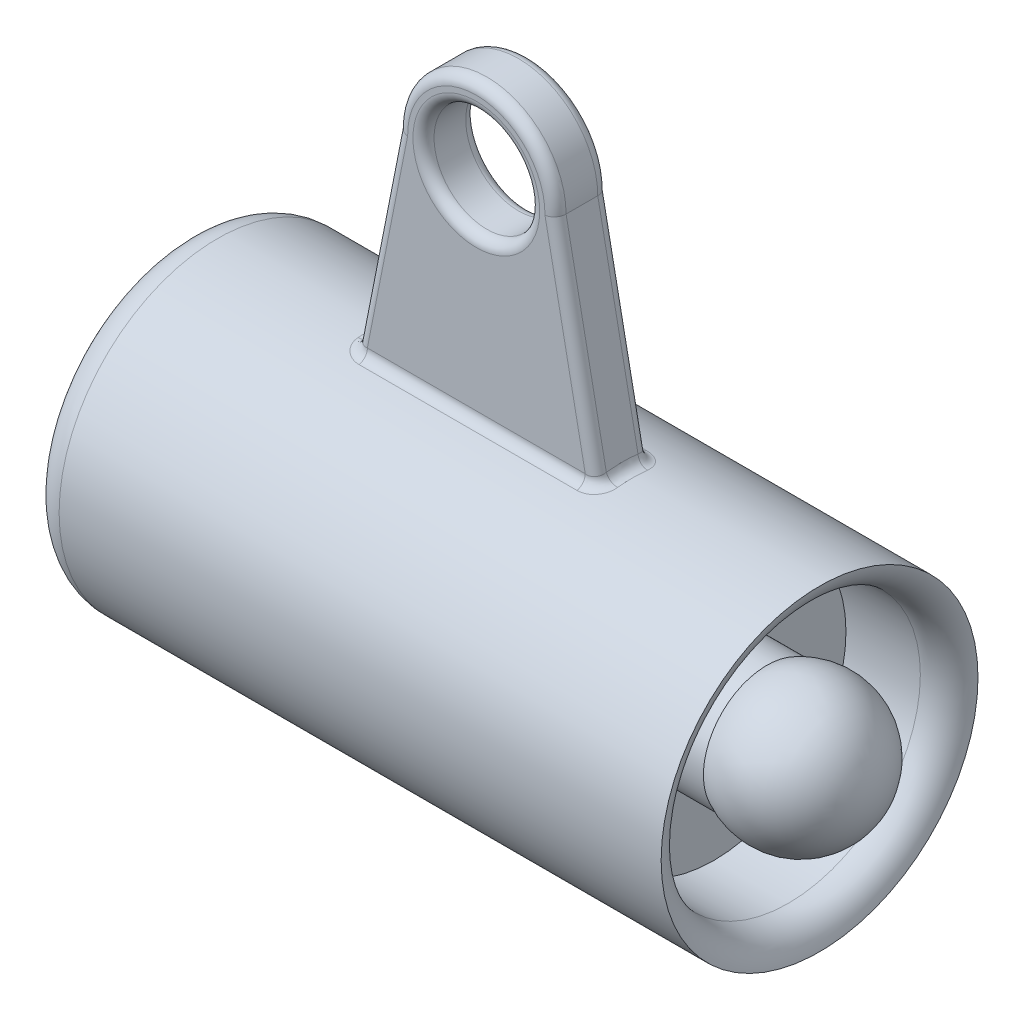
from build123d import *

# Parameters (mm, degrees)
SKETCH1_R           = 15
BOSS_EXTRUDE1_DEPTH = 30
SKETCH2_R           = 12.5
CUT_EXTRUDE1_DEPTH  = 9.99999999999999
SKETCH3_R           = 6
BOSS_EXTRUDE2_DEPTH = 5
FILLET1_R           = 3
FILLET2_R           = 3
BOSS_EXTRUDE3_DEPTH = 2.5
SKETCH6_R           = 4.999999999999999
CUT_EXTRUDE2_DEPTH  = 58.77110004145674
FILLET3_R           = 1


# Read off the part's stored shape, not the designer's step: Dome1
with BuildPart() as part:
    # Sketch1 → Boss-Extrude1 (new, symmetric)
    with BuildSketch(Plane(origin=(0, 0, 0), x_dir=(0, 0, -1), z_dir=(1, 0, 0))):
        Circle(SKETCH1_R)
    extrude(amount=BOSS_EXTRUDE1_DEPTH, both=True)

    # Sketch2 → Cut-Extrude1 (cut)
    with BuildSketch(Plane(origin=(30, 0, 0), x_dir=(0, 0, -1), z_dir=(1, 0, 0))):
        Circle(SKETCH2_R)
    extrude(amount=-CUT_EXTRUDE1_DEPTH, mode=Mode.SUBTRACT)

    # Sketch3 → Boss-Extrude2 (add)
    with BuildSketch(Plane(origin=(20.00000000000001, 0, 0), x_dir=(0, 0, -1), z_dir=(1, 0, 0))):
        Circle(SKETCH3_R)
    extrude(amount=BOSS_EXTRUDE2_DEPTH)

    # Dome1 outline → Dome1 (revolve)
    with BuildSketch(Plane.YX):
        with BuildLine():
            Line((0, 25), (5.999999999, 24.999999997))
            ThreePointArc((5.999999999, 24.999999997), (5.830951896, 31.698571136), (0, 35))
            Line((0, 35), (0, 25))
        make_face()
    revolve(axis=Axis((0, 0, 0), (1, 0, 0)))

    # Fillet1
    # the kernel refuses this fillet: 3 mm, written as the material it takes off along each edge
    with BuildSketch(Plane(origin=(30, 0, 0), x_dir=(0, 0, -1), z_dir=(0, -1, 0))) as fillet1_piece_1:
        with BuildLine():
            CenterArc((15.5, -2.9580398915501185), FILLET1_R, 99.59406822685946, 80.40593177314054)
            Line((12.5, -2.9580398915501185), (12.44, -2.9580398915501185))
            Line((12.44, -2.9580398915501185), (12.44, 0))
            Line((12.44, 0), (12.5, 0.05999999999999872))
            ThreePointArc((12.5, 0.05999999999999872), (13.750000000000025, 0.05999999999999872), (14.990000000000052, 0.05916079783069605))
            Line((14.990000000000052, 0.05916079783069605), (15.000000000000052, -3.0198e-13))
        make_face()
    revolve(axis=Axis((30, 0, 0), (1, 0, 0)), mode=Mode.SUBTRACT)

    # Fillet2
    fillet2_edges = [part.edges().sort_by_distance(p)[0] for p in [
        (-30, 8.5e-15, 15),
    ]]
    fillet(fillet2_edges, radius=FILLET2_R)

    # Sketch5 → Boss-Extrude3 (add, symmetric)
    with BuildSketch(Plane.XY):
        with BuildLine():
            Line((-7.5, 35), (-12.000000000000002, 12.246918388932729))
            Line((-12.000000000000002, 12.246918388932729), (11.999999999999998, 12.246918388932729))
            Line((11.999999999999998, 12.246918388932729), (7.5, 35))
            ThreePointArc((7.5, 35), (4.6e-16, 42.5), (-7.5, 35))
        make_face()
    extrude(amount=BOSS_EXTRUDE3_DEPTH, both=True)

    # Sketch6 → Cut-Extrude2 (cut, through all)
    with BuildSketch(Plane.XY.offset(2.5)):
        with Locations((0, 35)):
            Circle(SKETCH6_R)
    extrude(amount=-CUT_EXTRUDE2_DEPTH, mode=Mode.SUBTRACT)

    # Fillet3
    fillet3_edges = [part.edges().sort_by_distance(p)[0] for p in [
        (-1.78e-15, 14.79019945774904, -2.5),
        (11.455508160979097, 15, -1.84e-15),
        (-11.455508160979097, 15, 3.67e-15),
        (-1.78e-15, 14.79019945774904, 2.5),
        (9.498500774415835, 24.89509972887452, 2.5),
        (2.12e-15, 42.5, 2.5),
        (-9.498500774415836, 24.89509972887452, 2.5),
        (2.12e-15, 42.5, -2.5),
        (-9.498500774415836, 24.89509972887452, -2.5),
        (9.498500774415835, 24.89509972887452, -2.5),
        (-4.999999999999999, 35, -2.5),
        (-4.999999999999999, 35, 2.5),
    ]]
    fillet(fillet3_edges, radius=FILLET3_R)


solid = part.part
